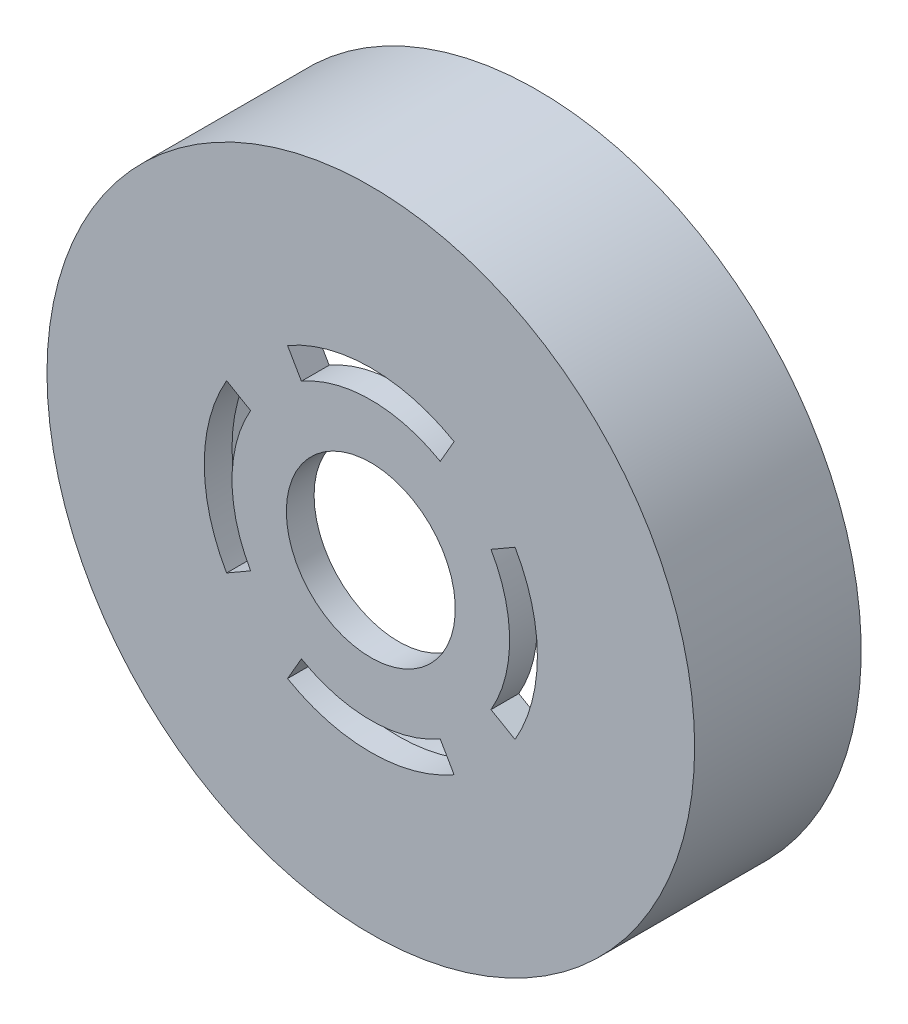
from build123d import *

# Parameters (mm, degrees)
SKETCH_2_R          = 35
SKETCH_2_R_2        = 5.5
EXTRUDE_1_DEPTH     = 5
EXTRUDE_START       = 15
SKETCH_3_R          = 35
SKETCH_3_R_2        = 30.1
EXTRUDE_2_DEPTH     = 15
SKETCH_4_R          = 1.55
CUT_EXTRUDE_1_DEPTH = 10
CUT_EXTRUDE_5_DEPTH = 15
FILLET_1_R          = 1
CUT_EXTRUDE_START   = -2
SKETCH_10_R         = 35
CUT_EXTRUDE_6_DEPTH = 2
CUT_EXTRUDE_7_DEPTH = 10
SKETCH1_R           = 9.130787709
CUT_EXTRUDE1_DEPTH  = 52.720402193


with BuildPart() as part:
    # 草图2 → 凸台-拉伸1 (new body)
    with BuildSketch(Plane.XY):
        Circle(SKETCH_2_R)
        Circle(SKETCH_2_R_2, mode=Mode.SUBTRACT)
    extrude(amount=EXTRUDE_1_DEPTH)

    # 草图3 → 凸台-拉伸2 (add)
    with BuildSketch(Plane(origin=(0, 0, 0), x_dir=(-1, 0, 0), z_dir=(0, 0, -1)).offset(EXTRUDE_START)):
        Circle(SKETCH_3_R)
        Circle(SKETCH_3_R_2, mode=Mode.SUBTRACT)
    extrude(amount=-EXTRUDE_2_DEPTH)

    # 草图4 → 切除-拉伸1 (cut)
    with BuildSketch(Plane(origin=(0, 0, -15), x_dir=(-1, 0, 0), z_dir=(0, 0, -1))):
        with Locations((0, 32.5)):
            Circle(SKETCH_4_R)
        with Locations((32.5, 0)):
            Circle(SKETCH_4_R)
        with Locations((0, -32.5)):
            Circle(SKETCH_4_R)
        with Locations((-32.5, 0)):
            Circle(SKETCH_4_R)
    extrude(amount=-CUT_EXTRUDE_1_DEPTH, mode=Mode.SUBTRACT)

    # 草图9 → 切除-拉伸5 (cut)
    with BuildSketch(Plane(origin=(0, 0, -15), x_dir=(-1, 0, 0), z_dir=(0, 0, -1))):
        with BuildLine():
            ThreePointArc((-22.013313369, 20.528615017), (-22.026376234, 22.026376234), (-20.528615017, 22.013313369))
            ThreePointArc((-20.528615017, 22.013313369), (-21.283914114, 21.283914114), (-22.013313369, 20.528615017))
        make_face()
        with BuildLine():
            ThreePointArc((20.528615017, 22.013313369), (22.026376234, 22.026376234), (22.013313369, 20.528615017))
            ThreePointArc((22.013313369, 20.528615017), (21.283914114, 21.283914114), (20.528615017, 22.013313369))
        make_face()
        with BuildLine():
            ThreePointArc((22.013313369, -20.528615017), (22.026376234, -22.026376234), (20.528615017, -22.013313369))
            ThreePointArc((20.528615017, -22.013313369), (21.283914114, -21.283914114), (22.013313369, -20.528615017))
        make_face()
        with BuildLine():
            ThreePointArc((-20.528615017, -22.013313369), (-22.026376234, -22.026376234), (-22.013313369, -20.528615017))
            ThreePointArc((-22.013313369, -20.528615017), (-21.283914114, -21.283914114), (-20.528615017, -22.013313369))
        make_face()
    extrude(amount=-CUT_EXTRUDE_5_DEPTH, mode=Mode.SUBTRACT)

    # 圆角1
    # the kernel refuses this fillet: 1 mm, written as the material it takes off along each edge
    with BuildSketch(Plane(origin=(0, 0, -15), x_dir=(-0.7403558797037455, 0.6722151228498904, 0), z_dir=(-0.6722151228498904, -0.7403558797037455, 0))) as fillet_1_piece_1:
        with BuildLine():
            CenterArc((30.1 + FILLET_1_R, -FILLET_1_R), FILLET_1_R, 90, 90)
            Line((30.1, -FILLET_1_R), (30.1, 0))
            Line((30.1, 0), (30.1 + FILLET_1_R, 0))
        make_face()
    revolve(axis=Axis((0, 0, -15), (0, 0, -1)), revolution_arc=95.523479776, mode=Mode.SUBTRACT)
    with BuildSketch(Plane(origin=(0, 0, -15), x_dir=(0.6722151228498918, 0.7403558797037441, 0), z_dir=(-0.7403558797037441, 0.6722151228498918, 0))) as fillet_1_piece_2:
        with BuildLine():
            CenterArc((30.1 + FILLET_1_R, -FILLET_1_R), FILLET_1_R, 90, 90)
            Line((30.1, -FILLET_1_R), (30.1, 0))
            Line((30.1, 0), (30.1 + FILLET_1_R, 0))
        make_face()
    revolve(axis=Axis((0, 0, -15), (0, 0, -1)), revolution_arc=95.523479776, mode=Mode.SUBTRACT)
    with BuildSketch(Plane(origin=(0, 0, -15), x_dir=(0.7403558797037453, -0.6722151228498905, 0), z_dir=(0.6722151228498905, 0.7403558797037453, 0))) as fillet_1_piece_3:
        with BuildLine():
            CenterArc((30.1 + FILLET_1_R, -FILLET_1_R), FILLET_1_R, 90, 90)
            Line((30.1, -FILLET_1_R), (30.1, 0))
            Line((30.1, 0), (30.1 + FILLET_1_R, 0))
        make_face()
    revolve(axis=Axis((0, 0, -15), (0, 0, -1)), revolution_arc=95.523479776, mode=Mode.SUBTRACT)
    with BuildSketch(Plane(origin=(0, 0, -15), x_dir=(-1, 0, 0), z_dir=(0, -1, 0))) as fillet_1_piece_4:
        with BuildLine():
            CenterArc((30.1 + FILLET_1_R, -FILLET_1_R), FILLET_1_R, 90, 90)
            Line((30.1, -FILLET_1_R), (30.1, 0))
            Line((30.1, 0), (30.1 + FILLET_1_R, 0))
        make_face()
    revolve(axis=Axis((0, 0, -15), (0, 0, -1)), revolution_arc=47.760430641, mode=Mode.SUBTRACT)
    with BuildSketch(Plane(origin=(0, 0, -15), x_dir=(-0.6722320403041436, -0.7403405189428228, 0), z_dir=(0.7403405189428228, -0.6722320403041436, 0))) as fillet_1_piece_5:
        with BuildLine():
            CenterArc((30.1 + FILLET_1_R, -FILLET_1_R), FILLET_1_R, 90, 90)
            Line((30.1, -FILLET_1_R), (30.1, 0))
            Line((30.1, 0), (30.1 + FILLET_1_R, 0))
        make_face()
    revolve(axis=Axis((0, 0, -15), (0, 0, -1)), revolution_arc=47.760430641, mode=Mode.SUBTRACT)

    # 草图10 → 切除-拉伸6 (cut)
    with BuildSketch(Plane.XY.offset(5).offset(CUT_EXTRUDE_START)):
        with Locations(Location((0, 0, 0), (0, 0, 180))):
            Circle(SKETCH_10_R)
    extrude(amount=CUT_EXTRUDE_6_DEPTH, mode=Mode.SUBTRACT)

    # 草图11 → 切除-拉伸7 (cut)
    with BuildSketch(Plane(origin=(0, 0, 0), x_dir=(-1, 0, 0), z_dir=(0, 0, -1))):
        with BuildLine():
            Line((12.990381057, 7.5), (15.588457268, 9))
            ThreePointArc((15.588457268, 9), (18, 0), (15.588457268, -9))
            Line((15.588457268, -9), (12.990381057, -7.5))
            ThreePointArc((12.990381057, -7.5), (15, 0), (12.990381057, 7.5))
        make_face()
        with BuildLine():
            Line((-7.5, 12.990381057), (-9, 15.588457268))
            ThreePointArc((-9, 15.588457268), (0, 18), (9, 15.588457268))
            Line((9, 15.588457268), (7.5, 12.990381057))
            ThreePointArc((7.5, 12.990381057), (0, 15), (-7.5, 12.990381057))
        make_face()
        with BuildLine():
            Line((7.5, -12.990381057), (9, -15.588457268))
            ThreePointArc((9, -15.588457268), (0, -18), (-9, -15.588457268))
            Line((-9, -15.588457268), (-7.5, -12.990381057))
            ThreePointArc((-7.5, -12.990381057), (0, -15), (7.5, -12.990381057))
        make_face()
        with BuildLine():
            Line((-12.990381057, -7.5), (-15.588457268, -9))
            ThreePointArc((-15.588457268, -9), (-18, 0), (-15.588457268, 9))
            Line((-15.588457268, 9), (-12.990381057, 7.5))
            ThreePointArc((-12.990381057, 7.5), (-15, 0), (-12.990381057, -7.5))
        make_face()
    extrude(amount=-CUT_EXTRUDE_7_DEPTH, mode=Mode.SUBTRACT)

    # Sketch1 → Cut-Extrude1 (cut, through all)
    with BuildSketch(Plane(origin=(0, 0, 0), x_dir=(-1, 0, 0), z_dir=(0, 0, -1))):
        Circle(SKETCH1_R)
    extrude(amount=-CUT_EXTRUDE1_DEPTH, mode=Mode.SUBTRACT)


solid = part.part
